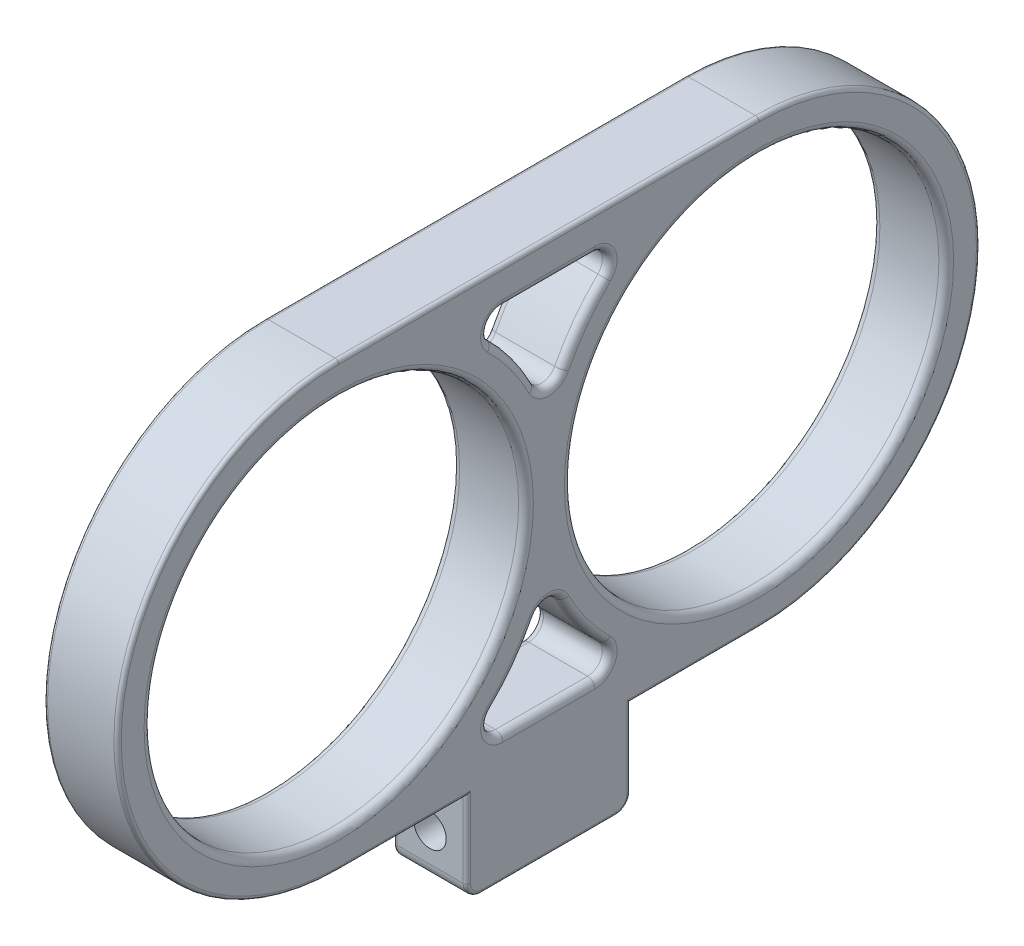
from build123d import *

# Parameters (mm, degrees)
SKETCH1_R           = 25.4
BOSS_EXTRUDE1_DEPTH = 10
FILLET1_R           = 2
FILLET4_R           = 2
FILLET3_R           = 1
FILLET2_R           = 0.5
CUT_EXTRUDE1_REACH  = 84.128
SKETCH2_R           = 2.2


with BuildPart() as part:
    # Sketch1 → Boss-Extrude1 (new body)
    with BuildSketch(Plane(origin=(0, 0, 0), x_dir=(0, 0, -1), z_dir=(1, 0, 0))):
        with BuildLine():
            Line((57, 30), (0, 30))
            ThreePointArc((0, 30), (-30, 0), (0, -30))
            Line((0, -30), (17.3748, -30))
            Line((17.3748, -30), (17.3748, -42.3952))
            Line((17.3748, -42.3952), (39.6252, -42.3952))
            Line((39.6252, -42.3952), (39.6252, -30))
            Line((39.6252, -30), (57, -30))
            ThreePointArc((57, -30), (87, 0), (57, 30))
        make_face()
        with BuildLine():
            Line((40.416876048, -25), (16.583123952, -25))
            ThreePointArc((16.583123952, -25), (23.858243939, -18.187473606), (28.5, -9.367496998))
            ThreePointArc((28.5, -9.367496998), (33.141756061, -18.187473606), (40.416876048, -25))
        make_face(mode=Mode.SUBTRACT)
        Circle(SKETCH1_R, mode=Mode.SUBTRACT)
        with Locations((57, 0)):
            Circle(SKETCH1_R, mode=Mode.SUBTRACT)
        with BuildLine():
            ThreePointArc((28.5, 9.367496998), (23.858243939, 18.187473606), (16.583123952, 25))
            Line((16.583123952, 25), (40.416876048, 25))
            ThreePointArc((40.416876048, 25), (33.141756061, 18.187473606), (28.5, 9.367496998))
        make_face(mode=Mode.SUBTRACT)
    extrude(amount=BOSS_EXTRUDE1_DEPTH)

    # Fillet1
    fillet1_edges = [part.edges().sort_by_distance(p)[0] for p in [
        (5, -42.3952, -39.6252),
        (5, -42.3952, -17.3748),
    ]]
    fillet(fillet1_edges, radius=FILLET1_R)

    # Fillet4
    fillet4_edges = [part.edges().sort_by_distance(p)[0] for p in [
        (5, -25, -40.416876048),
        (5, -9.367496998, -28.5),
        (5, -25, -16.583123952),
        (5, 9.367496998, -28.5),
        (5, 25, -40.416876048),
        (5, 25, -16.583123952),
    ]]
    fillet(fillet4_edges, radius=FILLET4_R)

    # Fillet3
    fillet3_edges = [part.edges().sort_by_distance(p)[0] for p in [
        (10, 0, -31.6),
        (0, 0, -31.6),
        (0, 0, 25.4),
        (10, 0, 25.4),
        (0, 12.551632211, -28.5),
        (0, 17.844575194, -24.115786036),
        (0, 23.75, -20.39454584),
        (0, 25, -28.5),
        (0, 23.75, -36.60545416),
        (0, -23.75, -20.39454584),
        (0, -17.844575194, -24.115786036),
        (0, -12.551632211, -28.5),
        (0, -17.844575194, -32.884213964),
        (0, -23.75, -36.60545416),
        (10, 17.844575194, -32.884213964),
        (10, 23.75, -36.60545416),
        (10, 25, -28.5),
        (10, 23.75, -20.39454584),
        (10, 17.844575194, -24.115786036),
        (10, -12.551632211, -28.5),
        (10, -17.844575194, -32.884213964),
        (10, -23.75, -36.60545416),
        (10, -25, -28.5),
        (10, -23.75, -20.39454584),
        (0, 17.844575194, -32.884213964),
        (0, -25, -28.5),
        (10, 12.551632211, -28.5),
        (10, -17.844575194, -24.115786036),
    ]]
    fillet(fillet3_edges, radius=FILLET3_R)

    # Fillet2
    fillet2_edges = [part.edges().sort_by_distance(p)[0] for p in [
        (0, -30, -48.3126),
        (0, 0, -87),
        (0, 30, -28.5),
        (0, 0, 30),
        (0, -35.1976, -39.6252),
        (0, -41.809413562, -39.039413562),
        (0, -42.3952, -28.5),
        (0, -41.809413562, -17.960586438),
        (10, -35.1976, -17.3748),
        (10, -41.809413562, -17.960586438),
        (10, -35.1976, -39.6252),
        (10, -41.809413562, -39.039413562),
        (10, -30, -48.3126),
        (10, 0, -87),
        (10, 30, -28.5),
        (10, 0, 30),
        (0, -30, -8.6874),
        (0, -35.1976, -17.3748),
        (10, -42.3952, -28.5),
        (10, -30, -8.6874),
    ]]
    fillet(fillet2_edges, radius=FILLET2_R)

    # Sketch2 → Cut-Extrude1 (cut, up to next)
    with BuildSketch(Plane.XY.offset(-17.3748), mode=Mode.PRIVATE) as cut_extrude1_sk1:
        with Locations((5, -36.35)):
            Circle(SKETCH2_R)
    cut_extrude1_tool1 = extrude(cut_extrude1_sk1.sketch, amount=-CUT_EXTRUDE1_REACH, mode=Mode.PRIVATE) & part.part
    add(cut_extrude1_tool1.solids().sort_by_distance((5, -36.35, -17.3748))[0], mode=Mode.SUBTRACT)


solid = part.part
